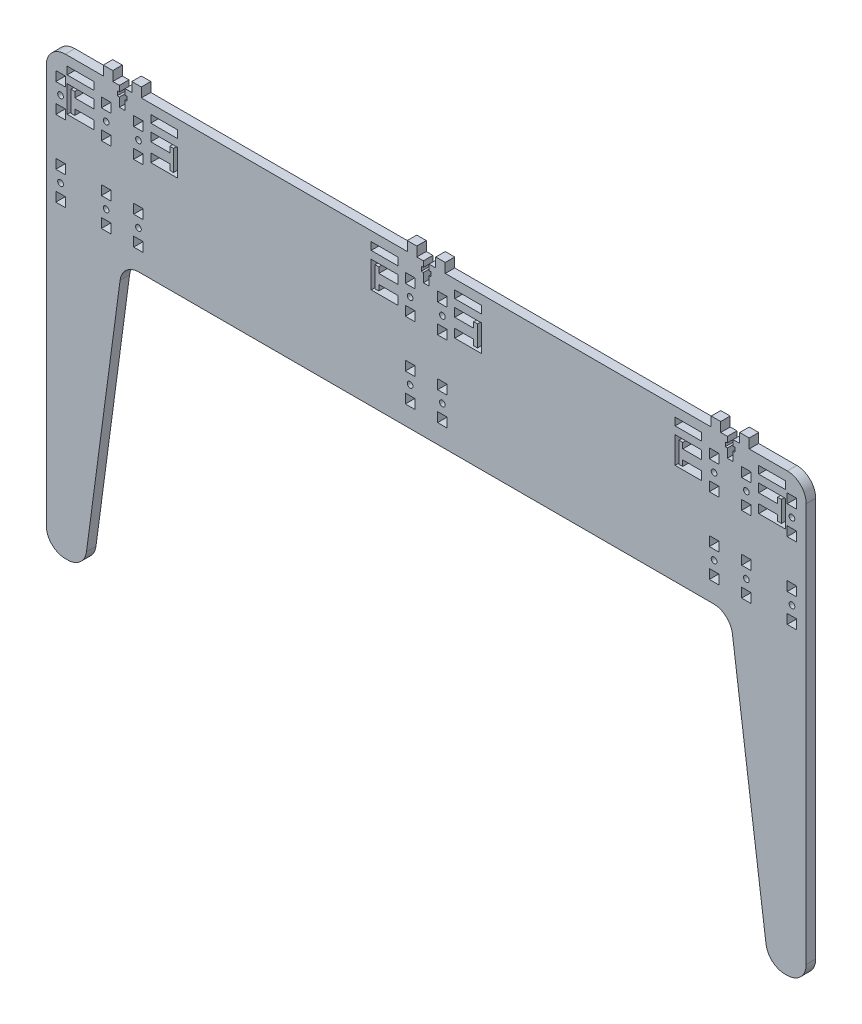
from build123d import *

# Parameters (mm, degrees)
BOSS_EXTRUDE1_OUTLINE_W   = 5
BOSS_EXTRUDE1_OUTLINE_H   = 5
BOSS_EXTRUDE1_OUTLINE_R   = 1.5
BOSS_EXTRUDE1_OUTLINE_W_2 = 14
BOSS_EXTRUDE1_OUTLINE_H_2 = 4
BOSS_EXTRUDE1_DEPTH       = 5
CONG_1_R                  = 10


# Read off the part's stored shape, not the designer's step: Boss-Extrude1
with BuildPart() as part:
    # Boss-Extrude1 outline → Boss-Extrude1 (new body)
    with BuildSketch(Plane.XY):
        Polygon((-150, 5), (-155, 5), (-155, 0), (-158.5, 0), (-158.5, -3), (-157.4, -3), (-157.4, -5.3), (-158.5, -5.3), (-158.5, -10), (-161.5, -10), (-161.5, -5.3), (-162.6, -5.3), (-162.6, -3), (-161.5, -3), (-161.5, 0), (-165, 0), (-165, 5), (-170, 5), (-170, 0), (-200, 0), (-200, -230), (-180, -230), (-160, -80), (160, -80), (180, -230), (200, -230), (200, 0), (170, 0), (170, 5), (165, 5), (165, 0), (161.5, 0), (161.5, -3), (162.6, -3), (162.6, -5.3), (161.5, -5.3), (161.5, -10), (158.5, -10), (158.5, -5.3), (157.4, -5.3), (157.4, -3), (158.5, -3), (158.5, 0), (155, 0), (155, 5), (150, 5), (150, 0), (10, 0), (10, 5), (5, 5), (5, 0), (1.5, 0), (1.5, -3), (2.6, -3), (2.6, -5.3), (1.5, -5.3), (1.5, -10), (-1.5, -10), (-1.5, -5.3), (-2.6, -5.3), (-2.6, -3), (-1.5, -3), (-1.5, 0), (-5, 0), (-5, 5), (-10, 5), (-10, 0), (-150, 0), align=None)
        with Locations((-192.5, -67.5)):
            Rectangle(BOSS_EXTRUDE1_OUTLINE_W, BOSS_EXTRUDE1_OUTLINE_H, mode=Mode.SUBTRACT)
        with Locations((-192.5, -60)):
            Circle(BOSS_EXTRUDE1_OUTLINE_R, mode=Mode.SUBTRACT)
        with Locations((-168.5, -67.5)):
            Rectangle(BOSS_EXTRUDE1_OUTLINE_W, BOSS_EXTRUDE1_OUTLINE_H, mode=Mode.SUBTRACT)
        with Locations((-151.5, -67.5)):
            Rectangle(BOSS_EXTRUDE1_OUTLINE_W, BOSS_EXTRUDE1_OUTLINE_H, mode=Mode.SUBTRACT)
        with Locations((-168.5, -60)):
            Circle(BOSS_EXTRUDE1_OUTLINE_R, mode=Mode.SUBTRACT)
        with Locations((-151.5, -60)):
            Circle(BOSS_EXTRUDE1_OUTLINE_R, mode=Mode.SUBTRACT)
        with Locations((-8.5, -67.5)):
            Rectangle(BOSS_EXTRUDE1_OUTLINE_W, BOSS_EXTRUDE1_OUTLINE_H, mode=Mode.SUBTRACT)
        with Locations((-8.5, -60)):
            Circle(BOSS_EXTRUDE1_OUTLINE_R, mode=Mode.SUBTRACT)
        with Locations((-192.5, -52.5)):
            Rectangle(BOSS_EXTRUDE1_OUTLINE_W, BOSS_EXTRUDE1_OUTLINE_H, mode=Mode.SUBTRACT)
        with Locations((-168.5, -52.5)):
            Rectangle(BOSS_EXTRUDE1_OUTLINE_W, BOSS_EXTRUDE1_OUTLINE_H, mode=Mode.SUBTRACT)
        with Locations((-151.5, -52.5)):
            Rectangle(BOSS_EXTRUDE1_OUTLINE_W, BOSS_EXTRUDE1_OUTLINE_H, mode=Mode.SUBTRACT)
        with Locations((-192.5, -27.5)):
            Rectangle(BOSS_EXTRUDE1_OUTLINE_W, BOSS_EXTRUDE1_OUTLINE_H, mode=Mode.SUBTRACT)
        with Locations((-168.5, -27.5)):
            Rectangle(BOSS_EXTRUDE1_OUTLINE_W, BOSS_EXTRUDE1_OUTLINE_H, mode=Mode.SUBTRACT)
        with Locations((-151.5, -27.5)):
            Rectangle(BOSS_EXTRUDE1_OUTLINE_W, BOSS_EXTRUDE1_OUTLINE_H, mode=Mode.SUBTRACT)
        with Locations((-192.5, -20)):
            Circle(BOSS_EXTRUDE1_OUTLINE_R, mode=Mode.SUBTRACT)
        Polygon((-189, -13), (-175, -13), (-175, -17.5), (-185, -17.5), (-185, -14.5), (-187, -14.5), (-187, -25.5), (-185, -25.5), (-185, -22.5), (-175, -22.5), (-175, -27), (-189, -27), align=None, mode=Mode.SUBTRACT)
        with Locations((-192.5, -12.5)):
            Rectangle(BOSS_EXTRUDE1_OUTLINE_W, BOSS_EXTRUDE1_OUTLINE_H, mode=Mode.SUBTRACT)
        with Locations((-168.5, -20)):
            Circle(BOSS_EXTRUDE1_OUTLINE_R, mode=Mode.SUBTRACT)
        with Locations((-151.5, -20)):
            Circle(BOSS_EXTRUDE1_OUTLINE_R, mode=Mode.SUBTRACT)
        with Locations((-168.5, -12.5)):
            Rectangle(BOSS_EXTRUDE1_OUTLINE_W, BOSS_EXTRUDE1_OUTLINE_H, mode=Mode.SUBTRACT)
        with Locations((-151.5, -12.5)):
            Rectangle(BOSS_EXTRUDE1_OUTLINE_W, BOSS_EXTRUDE1_OUTLINE_H, mode=Mode.SUBTRACT)
        with Locations((-182, -7)):
            Rectangle(BOSS_EXTRUDE1_OUTLINE_W_2, BOSS_EXTRUDE1_OUTLINE_H_2, mode=Mode.SUBTRACT)
        Polygon((-135, -17.5), (-145, -17.5), (-145, -13), (-131, -13), (-131, -27), (-145, -27), (-145, -22.5), (-135, -22.5), (-135, -25.5), (-133, -25.5), (-133, -14.5), (-135, -14.5), align=None, mode=Mode.SUBTRACT)
        with Locations((-138, -7)):
            Rectangle(BOSS_EXTRUDE1_OUTLINE_W_2, BOSS_EXTRUDE1_OUTLINE_H_2, mode=Mode.SUBTRACT)
        with Locations((-8.5, -52.5)):
            Rectangle(BOSS_EXTRUDE1_OUTLINE_W, BOSS_EXTRUDE1_OUTLINE_H, mode=Mode.SUBTRACT)
        with Locations((-8.5, -27.5)):
            Rectangle(BOSS_EXTRUDE1_OUTLINE_W, BOSS_EXTRUDE1_OUTLINE_H, mode=Mode.SUBTRACT)
        Polygon((-29, -13), (-15, -13), (-15, -17.5), (-25, -17.5), (-25, -14.5), (-27, -14.5), (-27, -25.5), (-25, -25.5), (-25, -22.5), (-15, -22.5), (-15, -27), (-29, -27), align=None, mode=Mode.SUBTRACT)
        with Locations((-8.5, -20)):
            Circle(BOSS_EXTRUDE1_OUTLINE_R, mode=Mode.SUBTRACT)
        with Locations((-8.5, -12.5)):
            Rectangle(BOSS_EXTRUDE1_OUTLINE_W, BOSS_EXTRUDE1_OUTLINE_H, mode=Mode.SUBTRACT)
        with Locations((-22, -7)):
            Rectangle(BOSS_EXTRUDE1_OUTLINE_W_2, BOSS_EXTRUDE1_OUTLINE_H_2, mode=Mode.SUBTRACT)
        with Locations((8.5, -67.5)):
            Rectangle(BOSS_EXTRUDE1_OUTLINE_W, BOSS_EXTRUDE1_OUTLINE_H, mode=Mode.SUBTRACT)
        with Locations((8.5, -60)):
            Circle(BOSS_EXTRUDE1_OUTLINE_R, mode=Mode.SUBTRACT)
        with Locations((151.5, -67.5)):
            Rectangle(BOSS_EXTRUDE1_OUTLINE_W, BOSS_EXTRUDE1_OUTLINE_H, mode=Mode.SUBTRACT)
        with Locations((168.5, -67.5)):
            Rectangle(BOSS_EXTRUDE1_OUTLINE_W, BOSS_EXTRUDE1_OUTLINE_H, mode=Mode.SUBTRACT)
        with Locations((151.5, -60)):
            Circle(BOSS_EXTRUDE1_OUTLINE_R, mode=Mode.SUBTRACT)
        with Locations((168.5, -60)):
            Circle(BOSS_EXTRUDE1_OUTLINE_R, mode=Mode.SUBTRACT)
        with Locations((192.5, -67.5)):
            Rectangle(BOSS_EXTRUDE1_OUTLINE_W, BOSS_EXTRUDE1_OUTLINE_H, mode=Mode.SUBTRACT)
        with Locations((192.5, -60)):
            Circle(BOSS_EXTRUDE1_OUTLINE_R, mode=Mode.SUBTRACT)
        with Locations((8.5, -52.5)):
            Rectangle(BOSS_EXTRUDE1_OUTLINE_W, BOSS_EXTRUDE1_OUTLINE_H, mode=Mode.SUBTRACT)
        with Locations((8.5, -27.5)):
            Rectangle(BOSS_EXTRUDE1_OUTLINE_W, BOSS_EXTRUDE1_OUTLINE_H, mode=Mode.SUBTRACT)
        with Locations((8.5, -20)):
            Circle(BOSS_EXTRUDE1_OUTLINE_R, mode=Mode.SUBTRACT)
        Polygon((25, -17.5), (15, -17.5), (15, -13), (29, -13), (29, -27), (15, -27), (15, -22.5), (25, -22.5), (25, -25.5), (27, -25.5), (27, -14.5), (25, -14.5), align=None, mode=Mode.SUBTRACT)
        with Locations((8.5, -12.5)):
            Rectangle(BOSS_EXTRUDE1_OUTLINE_W, BOSS_EXTRUDE1_OUTLINE_H, mode=Mode.SUBTRACT)
        with Locations((22, -7)):
            Rectangle(BOSS_EXTRUDE1_OUTLINE_W_2, BOSS_EXTRUDE1_OUTLINE_H_2, mode=Mode.SUBTRACT)
        with Locations((151.5, -52.5)):
            Rectangle(BOSS_EXTRUDE1_OUTLINE_W, BOSS_EXTRUDE1_OUTLINE_H, mode=Mode.SUBTRACT)
        with Locations((168.5, -52.5)):
            Rectangle(BOSS_EXTRUDE1_OUTLINE_W, BOSS_EXTRUDE1_OUTLINE_H, mode=Mode.SUBTRACT)
        with Locations((192.5, -52.5)):
            Rectangle(BOSS_EXTRUDE1_OUTLINE_W, BOSS_EXTRUDE1_OUTLINE_H, mode=Mode.SUBTRACT)
        with Locations((151.5, -27.5)):
            Rectangle(BOSS_EXTRUDE1_OUTLINE_W, BOSS_EXTRUDE1_OUTLINE_H, mode=Mode.SUBTRACT)
        with Locations((168.5, -27.5)):
            Rectangle(BOSS_EXTRUDE1_OUTLINE_W, BOSS_EXTRUDE1_OUTLINE_H, mode=Mode.SUBTRACT)
        with Locations((192.5, -27.5)):
            Rectangle(BOSS_EXTRUDE1_OUTLINE_W, BOSS_EXTRUDE1_OUTLINE_H, mode=Mode.SUBTRACT)
        Polygon((131, -13), (145, -13), (145, -17.5), (135, -17.5), (135, -14.5), (133, -14.5), (133, -25.5), (135, -25.5), (135, -22.5), (145, -22.5), (145, -27), (131, -27), align=None, mode=Mode.SUBTRACT)
        with Locations((138, -7)):
            Rectangle(BOSS_EXTRUDE1_OUTLINE_W_2, BOSS_EXTRUDE1_OUTLINE_H_2, mode=Mode.SUBTRACT)
        with Locations((151.5, -20)):
            Circle(BOSS_EXTRUDE1_OUTLINE_R, mode=Mode.SUBTRACT)
        with Locations((168.5, -20)):
            Circle(BOSS_EXTRUDE1_OUTLINE_R, mode=Mode.SUBTRACT)
        with Locations((151.5, -12.5)):
            Rectangle(BOSS_EXTRUDE1_OUTLINE_W, BOSS_EXTRUDE1_OUTLINE_H, mode=Mode.SUBTRACT)
        with Locations((168.5, -12.5)):
            Rectangle(BOSS_EXTRUDE1_OUTLINE_W, BOSS_EXTRUDE1_OUTLINE_H, mode=Mode.SUBTRACT)
        Polygon((185, -17.5), (175, -17.5), (175, -13), (189, -13), (189, -27), (175, -27), (175, -22.5), (185, -22.5), (185, -25.5), (187, -25.5), (187, -14.5), (185, -14.5), align=None, mode=Mode.SUBTRACT)
        with Locations((192.5, -20)):
            Circle(BOSS_EXTRUDE1_OUTLINE_R, mode=Mode.SUBTRACT)
        with Locations((192.5, -12.5)):
            Rectangle(BOSS_EXTRUDE1_OUTLINE_W, BOSS_EXTRUDE1_OUTLINE_H, mode=Mode.SUBTRACT)
        with Locations((182, -7)):
            Rectangle(BOSS_EXTRUDE1_OUTLINE_W_2, BOSS_EXTRUDE1_OUTLINE_H_2, mode=Mode.SUBTRACT)
    extrude(amount=BOSS_EXTRUDE1_DEPTH)

    # Congé1
    cong_1_edges = [part.edges().sort_by_distance(p)[0] for p in [
        (200, 0, 2.5),
        (200, -230, 2.5),
        (180, -230, 2.5),
        (160, -80, 2.5),
        (-160, -80, 2.5),
        (-180, -230, 2.5),
        (-200, -230, 2.5),
        (-200, 0, 2.5),
    ]]
    fillet(cong_1_edges, radius=CONG_1_R)


solid = part.part
